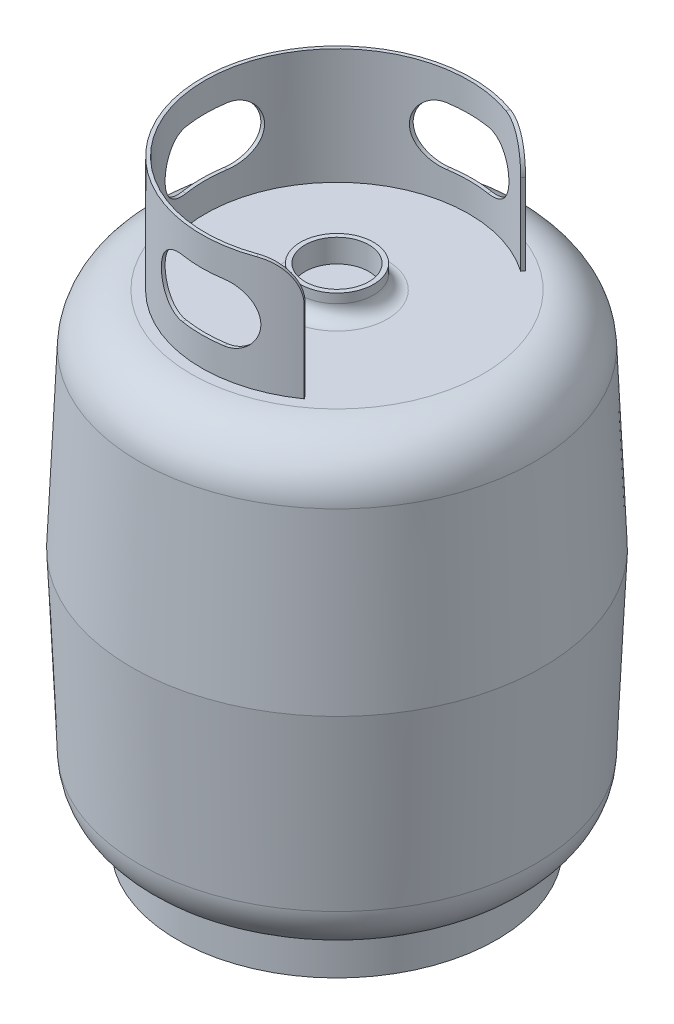
from build123d import *

# Parameters (mm, degrees)
SKETCH2_R           = 138.012780689
SKETCH2_R_2         = 129.012780689
BOSS_EXTRUDE1_DEPTH = 30
BOSS_EXTRUDE2_DEPTH = 100
CUT_EXTRUDE1_DEPTH  = 175
SKETCH5_R           = 27.590909091
CUT_EXTRUDE2_DEPTH  = 20
CUT_EXTRUDE4_DEPTH  = 200
FILLET1_R           = 30


with BuildPart() as part:
    # Sketch1 → Revolve3 (revolve)
    with BuildSketch(Plane.XY, mode=Mode.PRIVATE) as revolve3_sk:
        with BuildLine():
            Line((0, -193.75), (0, 150.712872431))
            Line((0, 150.712872431), (-170.969950661, 150.712872431))
            Line((-170.969950661, 150.712872431), (-177.550216779, 0))
            Line((-177.550216779, 0), (-170.969950661, -150.712872431))
            ThreePointArc((-170.969950661, -150.712872431), (-157.1308682, -181.256378293), (-126.012780689, -193.75))
            Line((-126.012780689, -193.75), (-43.590909091, -193.75))
            Line((-43.590909091, -193.75), (0, -193.75))
        make_face()
        with BuildLine():
            Line((-170.969950661, 150.712872431), (0, 150.712872431))
            Line((0, 150.712872431), (0, 213.75))
            Line((0, 213.75), (-31.590909091, 213.75))
            Line((-31.590909091, 213.75), (-31.590909091, 205.75))
            ThreePointArc((-31.590909091, 205.75), (-35.105627717, 197.264718626), (-43.590909091, 193.75))
            Line((-43.590909091, 193.75), (-126.012780689, 193.75))
            ThreePointArc((-126.012780689, 193.75), (-157.1308682, 181.256378293), (-170.969950661, 150.712872431))
        make_face()
    revolve(revolve3_sk.sketch.rotate(Axis((0, 251.534752036, 0), (0, -1, 0)), 270), axis=Axis((0, 251.534752036, 0), (0, -1, 0)))

    # Sketch3 → Boss-Extrude2 (add)
    with BuildSketch(Plane(origin=(0, 193.75, 0), x_dir=(1, 0, 0), z_dir=(0, 1, 0))):
        with BuildLine():
            Line((67.115773755, 95.85125851), (65.395044446, 93.393802377))
            ThreePointArc((65.395044446, 93.393802377), (-114.012691074, -0.142949536), (65.629033466, -93.229523901))
            Line((65.629033466, -93.229523901), (67.349768029, -95.686987575))
            ThreePointArc((67.349768029, -95.686987575), (-117.012693372, -0.142949519), (67.115773755, 95.85125851))
        make_face()
    extrude(amount=BOSS_EXTRUDE2_DEPTH)

    # Sketch4 → Cut-Extrude1 (cut, symmetric)
    with BuildSketch(Plane.XY):
        with BuildLine():
            Line((-18, 268.75), (18, 268.75))
            ThreePointArc((18, 268.75), (43, 243.75), (18, 218.75))
            Line((18, 218.75), (-18, 218.75))
            ThreePointArc((-18, 218.75), (-43, 243.75), (-18, 268.75))
        make_face()
    extrude(amount=CUT_EXTRUDE1_DEPTH, both=True, mode=Mode.SUBTRACT)

    # Sketch5 → Cut-Extrude2 (cut)
    with BuildSketch(Plane(origin=(0, 213.75, 0), x_dir=(1, 0, 0), z_dir=(0, 1, 0))):
        with Locations(Location((0, 0, 0), (0, 0, 270))):
            Circle(SKETCH5_R)
    extrude(amount=-CUT_EXTRUDE2_DEPTH, mode=Mode.SUBTRACT)

    # Sketch6 → Cut-Extrude4 (cut)
    with BuildSketch(Plane(origin=(0, 0, 0), x_dir=(0, 0, -1), z_dir=(1, 0, 0))):
        with BuildLine():
            Line((-18, 268.75), (18, 268.75))
            ThreePointArc((18, 268.75), (43, 243.75), (18, 218.75))
            Line((18, 218.75), (-18, 218.75))
            ThreePointArc((-18, 218.75), (-43, 243.75), (-18, 268.75))
        make_face()
    extrude(amount=-CUT_EXTRUDE4_DEPTH, mode=Mode.SUBTRACT)

    # Fillet1
    # the kernel refuses this fillet: 30 mm, written as the material it takes off along each edge
    with BuildSketch(Plane(origin=(110.134006482, 293.75, -157.287661831), x_dir=(0, -1, 0), z_dir=(-0.5735764363510437, 0, 0.8191520442889936))) as fillet1_piece_1:
        with BuildLine():
            CenterArc((FILLET1_R, -FILLET1_R), FILLET1_R, 90, 90)
            Line((0, -FILLET1_R), (0, 0))
            Line((0, 0), (FILLET1_R, 0))
        make_face()
    extrude(amount=153, mode=Mode.SUBTRACT)
    with BuildSketch(Plane(origin=(22.610801189, 293.75, 31.793120265), x_dir=(0, -1, 0), z_dir=(0.5735764303666857, 0, 0.8191520484792861))) as fillet1_piece_2:
        with BuildLine():
            CenterArc((FILLET1_R, -FILLET1_R), FILLET1_R, 90, 90)
            Line((0, -FILLET1_R), (0, 0))
            Line((0, 0), (FILLET1_R, 0))
        make_face()
    extrude(amount=153.00000919, mode=Mode.SUBTRACT)


with BuildPart() as body_2:
    # Sketch2 → Boss-Extrude1 (new body)
    with BuildSketch(Plane.XZ.offset(193.75)):
        with Locations(Location((0, 0, 0), (0, 0, 270))):
            Circle(SKETCH2_R)
        with Locations(Location((0, 0, 0), (0, 0, 270))):
            Circle(SKETCH2_R_2, mode=Mode.SUBTRACT)
    extrude(amount=BOSS_EXTRUDE1_DEPTH)


solid = Compound([part.part, body_2.part])
